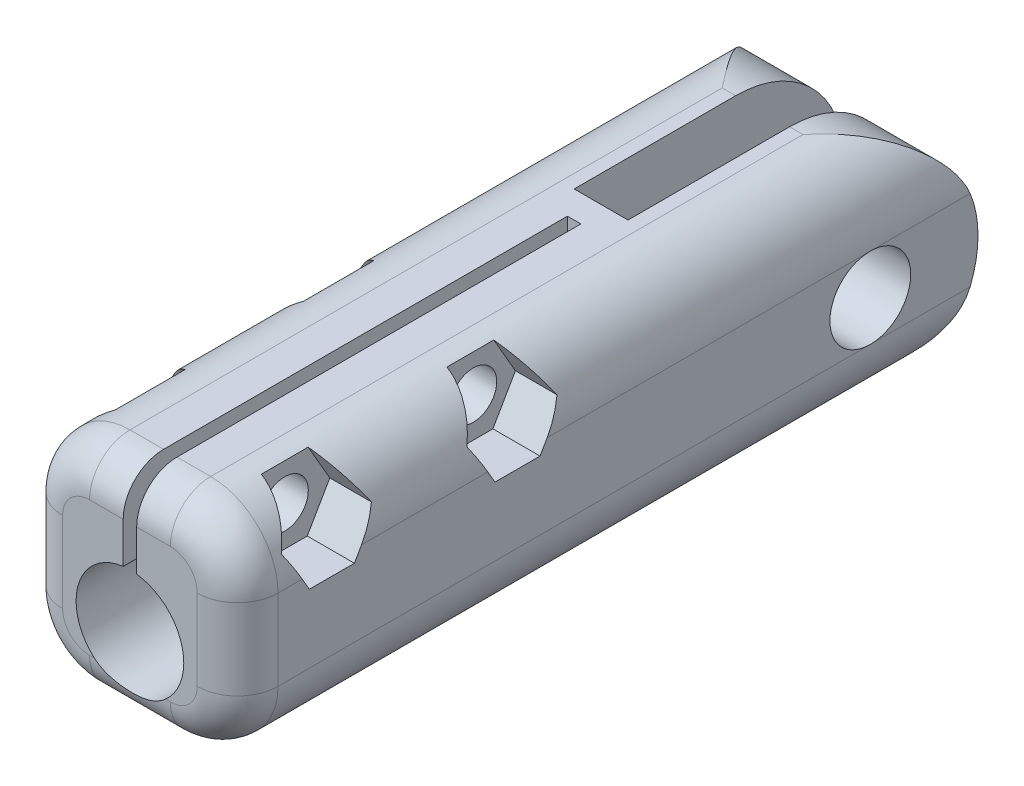
from build123d import *

# Parameters (mm, degrees)
SKETCH1_W               = 16
SKETCH1_H               = 16
BOSS_EXTRUDE1_DEPTH     = 55
SKETCH2_W               = 4
SKETCH2_H               = 17
CUT_EXTRUDE1_DEPTH      = 17
SKETCH3_R               = 3
CUT_EXTRUDE2_DEPTH      = 45
CUT_EXTRUDE3_DEPTH      = 33
FILLET1_R               = 5
FILLET2_R               = 3
CUT_EXTRUDE4_DEPTH      = 40
CUT_EXTRUDE4_DEPTH_BACK = 40
SKETCH5_R               = 1.75
CUT_EXTRUDE5_START      = -4
CUT_EXTRUDE5_DEPTH      = 40
CUT_EXTRUDE6_START      = -5
SKETCH7_R               = 3.5
CUT_EXTRUDE6_DEPTH      = 40
CUT_EXTRUDE7_DEPTH      = 58.835975073
CHAMFER1_SIZE2          = 16
CHAMFER1_SIZE           = 3


# Some blends are built 0.0001 mm under size
with BuildPart() as part:
    # Sketch1 → Boss-Extrude1 (new body)
    with BuildSketch(Plane.XY):
        Rectangle(SKETCH1_W, SKETCH1_H)
    extrude(amount=BOSS_EXTRUDE1_DEPTH)

    # Sketch2 → Cut-Extrude1 (cut)
    with BuildSketch(Plane(origin=(0, 8, 0), x_dir=(1, 0, 0), z_dir=(0, 1, 0))):
        with Locations((0, -8.5)):
            Rectangle(SKETCH2_W, SKETCH2_H)
    extrude(amount=-CUT_EXTRUDE1_DEPTH, mode=Mode.SUBTRACT)

    # Sketch3 → Cut-Extrude2 (cut)
    with BuildSketch(Plane(origin=(8, 0, 0), x_dir=(0, 0, -1), z_dir=(1, 0, 0))):
        with Locations((-8, 0)):
            Circle(SKETCH3_R)
    extrude(amount=-CUT_EXTRUDE2_DEPTH, mode=Mode.SUBTRACT)

    # Sketch4 → Cut-Extrude3 (cut)
    with BuildSketch(Plane.XY.offset(55)):
        with BuildLine():
            Line((0.5, 1.968626967), (0.5, 0.424558432))
            Line((0.5, 0.424558432), (-0.5, 0.424558432))
            Line((-0.5, 0.424558432), (-0.5, 1.968626967))
            ThreePointArc((-0.5, 1.968626967), (-2.645751311, -5), (4, -2))
            ThreePointArc((4, -2), (3, 0.645751311), (0.5, 1.968626967))
        make_face()
        with BuildLine():
            Line((-0.5, 0.424558432), (0.5, 0.424558432))
            Line((0.5, 0.424558432), (0.5, 1.968626967))
            ThreePointArc((0.5, 1.968626967), (0, 2), (-0.5, 1.968626967))
            Line((-0.5, 1.968626967), (-0.5, 0.424558432))
        make_face()
        with BuildLine():
            ThreePointArc((-0.5, 1.968626967), (0, 2), (0.5, 1.968626967))
            Line((0.5, 1.968626967), (0.5, 8))
            Line((0.5, 8), (-0.5, 8))
            Line((-0.5, 8), (-0.5, 1.968626967))
        make_face()
    extrude(amount=-CUT_EXTRUDE3_DEPTH, mode=Mode.SUBTRACT)

    # Fillet1
    fillet1_edges = [part.edges().sort_by_distance(p)[0] for p in [
        (8, -8, 27.5),
        (-8, -8, 27.5),
        (-8, 8, 27.5),
        (8, 8, 27.5),
    ]]
    fillet(fillet1_edges, radius=FILLET1_R - 0.0001)  # a hair under: the kernel refuses the full size

    # Fillet2
    # the kernel refuses this fillet: 3 mm, written as the material it takes off along each edge
    with BuildSketch(Plane(origin=(7, 8, 55), x_dir=(0, -1, 0), z_dir=(-1, 0, 0)), Plane(origin=(3.0001, 8, 55), x_dir=(0, -1, 0), z_dir=(-1, 0, 0))) as fillet2_piece_1:
        with BuildLine():
            CenterArc((FILLET2_R, -FILLET2_R), FILLET2_R, 90, 90)
            Line((0, -FILLET2_R), (0, 0))
            Line((0, 0), (FILLET2_R, 0))
        make_face()
    extrude(amount=10.0001, mode=Mode.SUBTRACT)
    with BuildSketch(Plane(origin=(8, -3.0001, 55), x_dir=(-1, 0, 0), z_dir=(0, 1, 0)), Plane(origin=(-8, 3.0001, 55), x_dir=(1, 0, 0), z_dir=(0, -1, 0))) as fillet2_piece_2:
        with BuildLine():
            CenterArc((FILLET2_R, -FILLET2_R), FILLET2_R, 90, 90)
            Line((0, -FILLET2_R), (0, 0))
            Line((0, 0), (FILLET2_R, 0))
        make_face()
    extrude(amount=6.0002, mode=Mode.SUBTRACT)
    with BuildSketch(Plane(origin=(-3.0001, -8, 55), x_dir=(0, 0, -1), z_dir=(1, 0, 0))) as fillet2_piece_3:
        with BuildLine():
            CenterArc((FILLET2_R, FILLET2_R), FILLET2_R, 180, 90)
            Line((0, FILLET2_R), (0, 0))
            Line((0, 0), (FILLET2_R, 0))
        make_face()
    extrude(amount=6.0002, mode=Mode.SUBTRACT)
    with BuildSketch(Plane(origin=(-3.0001, -3.0001, 55), x_dir=(0, -1, 0), z_dir=(1, 0, 0))) as fillet2_piece_4:
        with BuildLine():
            CenterArc((4.9999 - FILLET2_R, FILLET2_R), FILLET2_R, 270, 90)
            Line((4.9999 - FILLET2_R, 0), (4.9999, 0))
            Line((4.9999, 0), (4.9999, FILLET2_R))
        make_face()
    revolve(axis=Axis((-3.0001, -3.0001, 55), (0, 0, -1)), revolution_arc=90, mode=Mode.SUBTRACT)
    with BuildSketch(Plane(origin=(3.0001, -3.0001, 55), x_dir=(0, -1, 0), z_dir=(-1, 0, 0))) as fillet2_piece_5:
        with BuildLine():
            CenterArc((4.9999 - FILLET2_R, -FILLET2_R), FILLET2_R, 0, 90)
            Line((4.9999, -FILLET2_R), (4.9999, 0))
            Line((4.9999, 0), (4.9999 - FILLET2_R, 0))
        make_face()
    revolve(axis=Axis((3.0001, -3.0001, 55), (0, 0, 1)), revolution_arc=90, mode=Mode.SUBTRACT)
    with BuildSketch(Plane(origin=(-3.0001, 3.0001, 55), x_dir=(-1, 0, 0), z_dir=(0, -1, 0))) as fillet2_piece_6:
        with BuildLine():
            CenterArc((4.9999 - FILLET2_R, FILLET2_R), FILLET2_R, 270, 90)
            Line((4.9999, FILLET2_R), (4.9999, 0))
            Line((4.9999, 0), (4.9999 - FILLET2_R, 0))
        make_face()
    revolve(axis=Axis((-3.0001, 3.0001, 55), (0, 0, -1)), revolution_arc=90, mode=Mode.SUBTRACT)
    with BuildSketch(Plane(origin=(3.0001, 3.0001, 55), x_dir=(1, 0, 0), z_dir=(0, -1, 0))) as fillet2_piece_7:
        with BuildLine():
            CenterArc((4.9999 - FILLET2_R, -FILLET2_R), FILLET2_R, 0, 90)
            Line((4.9999, -FILLET2_R), (4.9999, 0))
            Line((4.9999, 0), (4.9999 - FILLET2_R, 0))
        make_face()
    revolve(axis=Axis((3.0001, 3.0001, 55), (0, 0, 1)), revolution_arc=90, mode=Mode.SUBTRACT)

    # Sketch5 → Cut-Extrude4 (cut, two sides: drawn at the far end of the back side and taken through both)
    with BuildSketch(Plane.ZY.offset(-0.5).offset(-CUT_EXTRUDE4_DEPTH_BACK)):
        with Locations(Location((48, 4.984313483, 0), (0, 0, 90))):
            Circle(SKETCH5_R)
        with Locations(Location((34, 4.984313483, 0), (0, 0, 90))):
            Circle(SKETCH5_R)
    extrude(amount=CUT_EXTRUDE4_DEPTH + CUT_EXTRUDE4_DEPTH_BACK, mode=Mode.SUBTRACT)

    # Sketch6 → Cut-Extrude5 (cut)
    with BuildSketch(Plane.ZY.offset(-0.5).offset(CUT_EXTRUDE5_START)):
        Polygon((49.674315781, 7.884313483), (46.325684219, 7.884313483), (44.651368439, 4.984313483), (46.325684219, 2.084313483), (49.674315781, 2.084313483), (51.348631561, 4.984313483), align=None)
        Polygon((35.885086056, 7.884313483), (32.536454495, 7.884313483), (30.862138714, 4.984313483), (32.536454495, 2.084313483), (35.885086056, 2.084313483), (37.559401836, 4.984313483), align=None)
    extrude(amount=-CUT_EXTRUDE5_DEPTH, mode=Mode.SUBTRACT)

    # Sketch7 → Cut-Extrude6 (cut)
    with BuildSketch(Plane(origin=(-0.5, 0, 0), x_dir=(0, 0, -1), z_dir=(1, 0, 0)).offset(CUT_EXTRUDE6_START)):
        with Locations((-48, 4.984313483)):
            Circle(SKETCH7_R)
        with Locations((-34, 4.984313483)):
            Circle(SKETCH7_R)
    extrude(amount=-CUT_EXTRUDE6_DEPTH, mode=Mode.SUBTRACT)

    # Sketch8 → Cut-Extrude7 (cut, through all)
    with BuildSketch(Plane.ZY.offset(8)):
        with BuildLine():
            Line((8, 8), (8.268392061, 14.01403494))
            ThreePointArc((8.268392061, 14.01403494), (-6.01403494, 0.268392061), (7.731607939, -14.01403494))
            Line((7.731607939, -14.01403494), (8, -8))
            ThreePointArc((8, -8), (0, 0), (8, 8))
        make_face()
    extrude(amount=-CUT_EXTRUDE7_DEPTH, mode=Mode.SUBTRACT)

    # Chamfer1
    chamfer1_edges = [part.edges().sort_by_distance(p)[0] for p in [
        (0, 8, 17),
    ]]
    chamfer1_side = [part.faces().sort_by_distance(p)[0] for p in [
        (0, 8, 17.06),
    ]]
    chamfer(chamfer1_edges, length=CHAMFER1_SIZE - 0.0001, length2=CHAMFER1_SIZE2 - 0.0001, reference=chamfer1_side[0])  # a hair under: the kernel refuses the full size


solid = part.part
